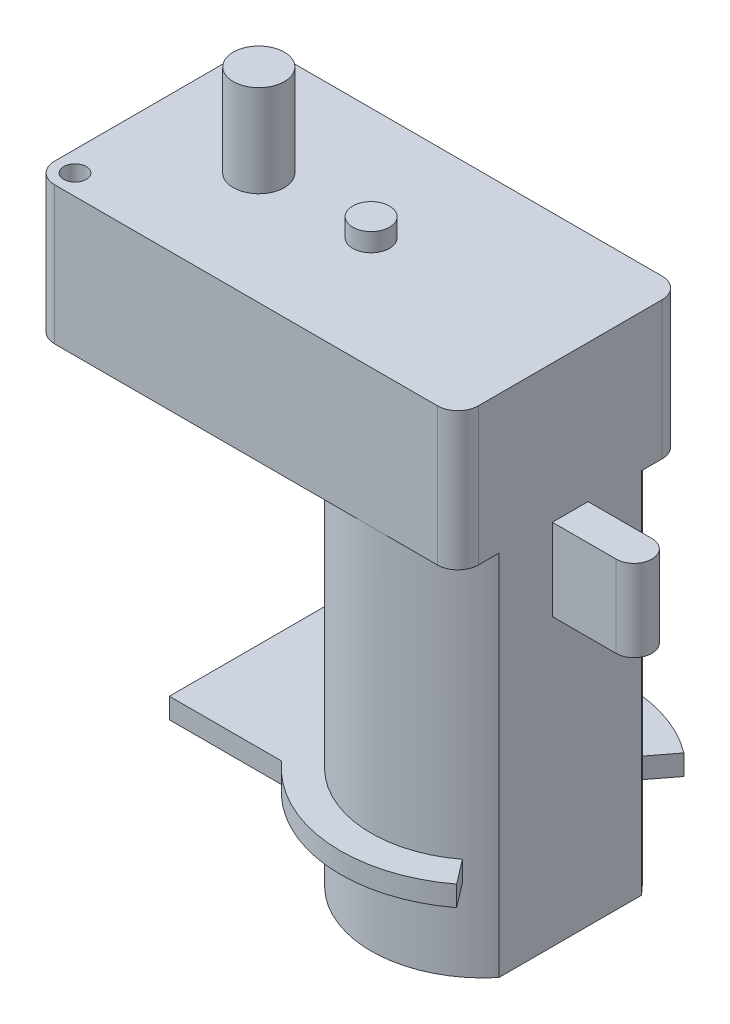
from build123d import *

# Parameters (mm, degrees)
SKETCH1_W           = 41.5
SKETCH1_H           = 22
BASE_DEPTH          = 13.5
FILLET1_R           = 2
SKETCH2_R           = 1.1
SCREWHOLE_DEPTH     = 13.5
SKETCH3_R           = 2.5
SPINAXEL_DEPTH      = 9
SKETCH4_R           = 1.8
FITTINGKNOB_DEPTH   = 1.8
BOSS_EXTRUDE4_DEPTH = 36
EXTRUDE_THIN1_DEPTH = 2
SKETCH7_W           = 3.5
SKETCH7_H           = 8
BOSS_EXTRUDE5_DEPTH = 8
FILLET2_RADIUS      = 1.75
FILLET2_LENGTH      = 8


# Read off the part's stored shape, not the designer's step: Extrude-Thin1
with BuildPart() as part:
    # Sketch1 → Base (new body)
    with BuildSketch(Plane(origin=(0, 0, 0), x_dir=(1, 0, 0), z_dir=(0, 1, 0))):
        Rectangle(SKETCH1_W, SKETCH1_H)
    extrude(amount=BASE_DEPTH)

    # Fillet1
    fillet1_edges = [part.edges().sort_by_distance(p)[0] for p in [
        (20.75, 6.75, 11),
        (-20.75, 6.75, 11),
        (-20.75, 6.75, -11),
        (20.75, 6.75, -11),
    ]]
    fillet(fillet1_edges, radius=FILLET1_R)

    # Sketch2 → ScrewHole (cut)
    with BuildSketch(Plane(origin=(0, 13.5, 0), x_dir=(1, 0, 0), z_dir=(0, 1, 0))):
        with Locations(Location((-18.75, 9, 0), (0, 0, 270))):
            Circle(SKETCH2_R)
        with Locations(Location((-18.75, -9, 0), (0, 0, 270))):
            Circle(SKETCH2_R)
    extrude(amount=-SCREWHOLE_DEPTH, mode=Mode.SUBTRACT)

    # Sketch3 → SpinAxel (add)
    with BuildSketch(Plane(origin=(0, 13.5, 0), x_dir=(1, 0, 0), z_dir=(0, 1, 0))):
        with Locations(Location((-9.75, 0, 0), (0, 0, 270))):
            Circle(SKETCH3_R)
    extrude(amount=SPINAXEL_DEPTH)

    # Sketch4 → FittingKnob (add)
    with BuildSketch(Plane(origin=(0, 13.5, 0), x_dir=(1, 0, 0), z_dir=(0, 1, 0))):
        with Locations(Location((1.25, 0, 0), (0, 0, 270))):
            Circle(SKETCH4_R)
    extrude(amount=FITTINGKNOB_DEPTH)

    # Sketch5 → Boss-Extrude4 (add)
    with BuildSketch(Plane(origin=(0, 0, 0), x_dir=(-1, 0, 0), z_dir=(0, -1, 0))):
        with BuildLine():
            Line((-3.75, -6.982120022), (-3.75, 6.982120022))
            ThreePointArc((-3.75, 6.982120022), (-12.25, 11), (-20.75, 6.982120022))
            Line((-20.75, 6.982120022), (-20.75, -6.982120022))
            ThreePointArc((-20.75, -6.982120022), (-12.25, -11), (-3.75, -6.982120022))
        make_face()
    extrude(amount=BOSS_EXTRUDE4_DEPTH)

    # Extrude-Thin1 outline → Extrude-Thin1 (add)
    with BuildSketch(Plane(origin=(0, -26, 0), x_dir=(-1, 0, 0), z_dir=(0, -1, 0))):
        with BuildLine():
            ThreePointArc((-3.75, -6.982120022), (-10.984143444, -10.926921212), (-18.928571429, -8.740519646))
            Line((-18.928571429, -8.740519646), (-20.75, -11.124297731))
            ThreePointArc((-20.75, -11.124297731), (-10.882966454, -13.933097979), (-1.75, -9.260129589))
            Line((-1.75, -9.260129589), (9.25, -9.260129589))
            Line((9.25, -9.260129589), (9.25, 9.260129589))
            Line((9.25, 9.260129589), (-1.75, 9.260129589))
            ThreePointArc((-1.75, 9.260129589), (-10.882966454, 13.933097979), (-20.75, 11.124297731))
            Line((-20.75, 11.124297731), (-18.928571429, 8.740519646))
            ThreePointArc((-18.928571429, 8.740519646), (-10.984143444, 10.926921212), (-3.75, 6.982120022))
            Line((-3.75, 6.982120022), (-3.75, -6.982120022))
        make_face()
    extrude(amount=EXTRUDE_THIN1_DEPTH)

    # Sketch7 → Boss-Extrude5 (add)
    with BuildSketch(Plane(origin=(20.75, 0, 0), x_dir=(0, 0, -1), z_dir=(1, 0, 0))):
        with Locations((0, -4)):
            Rectangle(SKETCH7_W, SKETCH7_H)
    extrude(amount=BOSS_EXTRUDE5_DEPTH)

    # Fillet2: full round fillet: the end face becomes a half cylinder, R = half its width
    fillet2_face = Plane((28.75, -4, 0), x_dir=(0, 1, 0), z_dir=(1, 0, 0))  # on the end face: x along it, z out of the body
    fillet2_slab = fillet2_face.offset(-FILLET2_RADIUS / 2) * Box(FILLET2_LENGTH, 2 * FILLET2_RADIUS, FILLET2_RADIUS, mode=Mode.PRIVATE)  # the body's end, R deep
    fillet2_round = Plane((27, -4, 0), x_dir=(1, 0, 0), z_dir=(0, 1, 0)) * Cylinder(FILLET2_RADIUS, FILLET2_LENGTH, mode=Mode.PRIVATE)  # its axis R under the face
    add(fillet2_slab - fillet2_round, mode=Mode.SUBTRACT)


solid = part.part
